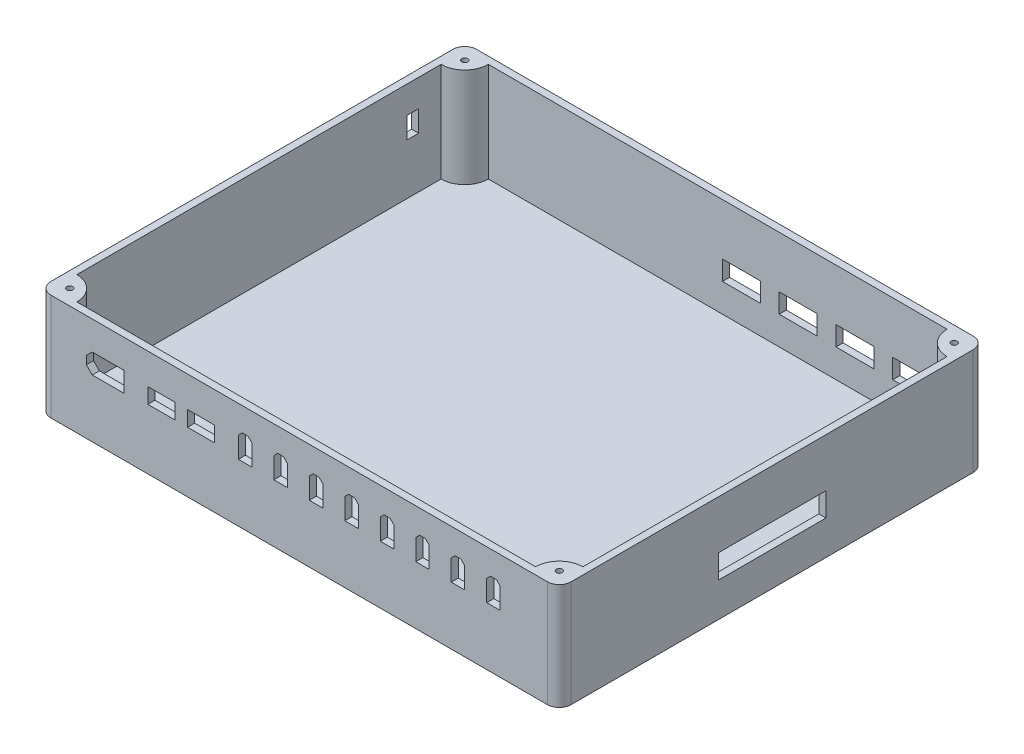
from build123d import *

# Parameters (mm, degrees)
SKETCH1_W           = 220
SKETCH1_H           = 180
BOSS_EXTRUDE1_DEPTH = 45
FILLET1_R           = 5
CUT_EXTRUDE7_DEPTH  = 42
CUT_EXTRUDE2_DEPTH  = 5
CUT_EXTRUDE3_DEPTH  = 5
SKETCH4_W           = 11.5
SKETCH4_H           = 6.5
CUT_EXTRUDE4_DEPTH  = 5
SKETCH5_W           = 45.536818034
SKETCH5_H           = 10
CUT_EXTRUDE5_DEPTH  = 5
SKETCH6_W           = 16
SKETCH6_H           = 8.2
CUT_EXTRUDE6_DEPTH  = 5
SKETCH8_W           = 5
SKETCH8_H           = 9
CUT_EXTRUDE8_DEPTH  = 4.2
SKETCH10_R          = 1.25
CUT_EXTRUDE9_DEPTH  = 40


with BuildPart() as part:
    # Sketch1 → Boss-Extrude1 (new body)
    with BuildSketch(Plane(origin=(0, 0, 0), x_dir=(1, 0, 0), z_dir=(0, 1, 0))):
        with Locations((110, 90)):
            Rectangle(SKETCH1_W, SKETCH1_H)
    extrude(amount=BOSS_EXTRUDE1_DEPTH)

    # Fillet1
    fillet1_edges = [part.edges().sort_by_distance(p)[0] for p in [
        (0, 22.5, -180),
        (0, 22.5, 0),
        (220, 22.5, -180),
        (220, 22.5, 0),
    ]]
    fillet(fillet1_edges, radius=FILLET1_R)

    # Sketch7 → Cut-Extrude7 (cut)
    with BuildSketch(Plane(origin=(0, 45, 0), x_dir=(1, 0, 0), z_dir=(0, 1, 0))):
        with BuildLine():
            Line((207, 177), (13, 177))
            ThreePointArc((13, 177), (10.071067812, 169.928932188), (3, 167))
            Line((3, 167), (3, 13))
            ThreePointArc((3, 13), (10.071067812, 10.071067812), (13, 3))
            Line((13, 3), (207, 3))
            ThreePointArc((207, 3), (209.928932188, 10.071067812), (217, 13))
            Line((217, 13), (217, 167))
            ThreePointArc((217, 167), (209.928932188, 169.928932188), (207, 177))
        make_face()
    extrude(amount=-CUT_EXTRUDE7_DEPTH, mode=Mode.SUBTRACT)

    # Sketch2 → Cut-Extrude2 (cut)
    with BuildSketch(Plane.XY):
        Polygon((175.9, 35), (178.4, 35), (180, 33.4), (180, 24.5), (174.3, 24.5), (174.3, 33.4), align=None)
        Polygon((190.9, 35), (193.4, 35), (195, 33.4), (195, 24.5), (189.3, 24.5), (189.3, 33.4), align=None)
        Polygon((160.9, 35), (163.4, 35), (165, 33.4), (165, 24.5), (159.3, 24.5), (159.3, 33.4), align=None)
        Polygon((145.9, 35), (148.4, 35), (150, 33.4), (150, 24.5), (144.3, 24.5), (144.3, 33.4), align=None)
        Polygon((130.9, 35), (133.4, 35), (135, 33.4), (135, 24.5), (129.3, 24.5), (129.3, 33.4), align=None)
        Polygon((115.9, 35), (118.4, 35), (120, 33.4), (120, 24.5), (114.3, 24.5), (114.3, 33.4), align=None)
        Polygon((100.9, 35), (103.4, 35), (105, 33.4), (105, 24.5), (99.3, 24.5), (99.3, 33.4), align=None)
        Polygon((85.9, 35), (88.4, 35), (90, 33.4), (90, 24.5), (84.3, 24.5), (84.3, 33.4), align=None)
    extrude(amount=-CUT_EXTRUDE2_DEPTH, mode=Mode.SUBTRACT)

    # Sketch3 → Cut-Extrude3 (cut)
    with BuildSketch(Plane.XY):
        Polygon((22.5, 32.9), (36, 32.9), (36, 24.5), (22.5, 24.5), (20, 27), (20, 30.4), align=None)
    extrude(amount=-CUT_EXTRUDE3_DEPTH, mode=Mode.SUBTRACT)

    # Sketch4 → Cut-Extrude4 (cut)
    with BuildSketch(Plane.XY):
        with Locations((51.75, 28.75)):
            Rectangle(SKETCH4_W, SKETCH4_H)
        with Locations((68.55, 28.75)):
            Rectangle(SKETCH4_W, SKETCH4_H)
    extrude(amount=-CUT_EXTRUDE4_DEPTH, mode=Mode.SUBTRACT)

    # Sketch5 → Cut-Extrude5 (cut)
    with BuildSketch(Plane(origin=(220, 0, 0), x_dir=(0, 0, -1), z_dir=(1, 0, 0))):
        with Locations((90, 19.480228536)):
            Rectangle(SKETCH5_W, SKETCH5_H)
    extrude(amount=-CUT_EXTRUDE5_DEPTH, mode=Mode.SUBTRACT)

    # Sketch6 → Cut-Extrude6 (cut)
    with BuildSketch(Plane(origin=(0, 0, -180), x_dir=(-1, 0, 0), z_dir=(0, 0, -1))):
        with Locations((-192, 19.1)):
            Rectangle(SKETCH6_W, SKETCH6_H)
        with Locations((-168, 19.1)):
            Rectangle(SKETCH6_W, SKETCH6_H)
        with Locations((-144, 19.1)):
            Rectangle(SKETCH6_W, SKETCH6_H)
        with Locations((-120, 19.1)):
            Rectangle(SKETCH6_W, SKETCH6_H)
    extrude(amount=-CUT_EXTRUDE6_DEPTH, mode=Mode.SUBTRACT)

    # Sketch8 → Cut-Extrude8 (cut)
    with BuildSketch(Plane.ZY):
        with Locations((-155.038386618, 29)):
            Rectangle(SKETCH8_W, SKETCH8_H)
    extrude(amount=-CUT_EXTRUDE8_DEPTH, mode=Mode.SUBTRACT)

    # Sketch10 → Cut-Extrude9 (cut)
    with BuildSketch(Plane(origin=(0, 45, 0), x_dir=(1, 0, 0), z_dir=(0, 1, 0))):
        with Locations((6.5, 173.5)):
            Circle(SKETCH10_R)
        with Locations((213.5, 173.5)):
            Circle(SKETCH10_R)
        with Locations((213.5, 6.5)):
            Circle(SKETCH10_R)
        with Locations((6.5, 6.5)):
            Circle(SKETCH10_R)
    extrude(amount=-CUT_EXTRUDE9_DEPTH, mode=Mode.SUBTRACT)


solid = part.part
